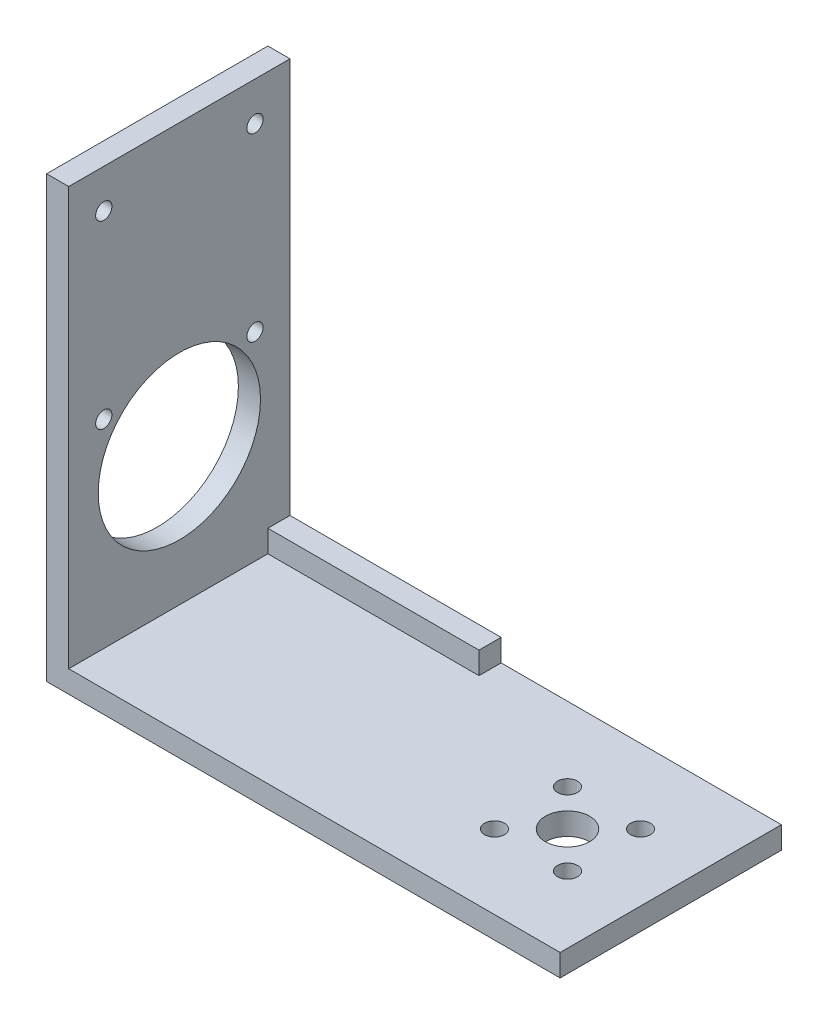
from build123d import *

# Parameters (mm, degrees)
S_BOX1_W      = 69.625
S_BOX1_H      = 3
BOSS_1_DEPTH  = 30
S_BOX2_W      = 3
S_BOX2_H      = 57.125
BOSS_2_DEPTH  = 30
S_BOX3_W      = 29.125
S_BOX3_H      = 3.5
BOSS_3_DEPTH  = 3
S_HOLE4_R     = 3
HOLE_4_DEPTH  = 3.2
S_HOLE5_R     = 1.35
HOLE_5_DEPTH  = 3.2
S_HOLE6_R     = 1.35
HOLE_6_DEPTH  = 3.2
S_HOLE7_R     = 1.35
HOLE_7_DEPTH  = 3.2
S_HOLE8_R     = 1.35
HOLE_8_DEPTH  = 3.2
S_HOLE9_R     = 11
HOLE_9_DEPTH  = 3.2
S_HOLE10_R    = 1.1
HOLE_10_DEPTH = 3.2
S_HOLE11_R    = 1.1
HOLE_11_DEPTH = 3.2
S_HOLE12_R    = 1.1
HOLE_12_DEPTH = 3.2
S_HOLE13_R    = 1.1
HOLE_13_DEPTH = 3.2


with BuildPart() as part:
    # S_box1 → Boss_1 (new body)
    with BuildSketch(Plane.XY.offset(-15)):
        with Locations((-20.8125, -20.125)):
            Rectangle(S_BOX1_W, S_BOX1_H)
    extrude(amount=BOSS_1_DEPTH)

    # S_box2 → Boss_2 (add)
    with BuildSketch(Plane.XY.offset(-15)):
        with Locations((-54.125, 9.4375)):
            Rectangle(S_BOX2_W, S_BOX2_H)
    extrude(amount=BOSS_2_DEPTH)

    # S_box3 → Boss_3 (add)
    with BuildSketch(Plane.XY.offset(-15)):
        with Locations((-38.5625, -17.375)):
            Rectangle(S_BOX3_W, S_BOX3_H)
    extrude(amount=BOSS_3_DEPTH)

    # S_hole4 → Hole_4 (cut)
    with BuildSketch(Plane(origin=(0, -21.725, 0), x_dir=(1, 0, 0), z_dir=(0, 1, 0))):
        Circle(S_HOLE4_R)
    extrude(amount=HOLE_4_DEPTH, mode=Mode.SUBTRACT)

    # S_hole5 → Hole_5 (cut)
    with BuildSketch(Plane(origin=(0, -21.725, 0), x_dir=(1, 0, 0), z_dir=(0, 1, 0))):
        with Locations((4.949747468, -4.949747468)):
            Circle(S_HOLE5_R)
    extrude(amount=HOLE_5_DEPTH, mode=Mode.SUBTRACT)

    # S_hole6 → Hole_6 (cut)
    with BuildSketch(Plane(origin=(0, -21.725, 0), x_dir=(1, 0, 0), z_dir=(0, 1, 0))):
        with Locations((-4.949747468, -4.949747468)):
            Circle(S_HOLE6_R)
    extrude(amount=HOLE_6_DEPTH, mode=Mode.SUBTRACT)

    # S_hole7 → Hole_7 (cut)
    with BuildSketch(Plane(origin=(0, -21.725, 0), x_dir=(1, 0, 0), z_dir=(0, 1, 0))):
        with Locations((-4.949747468, 4.949747468)):
            Circle(S_HOLE7_R)
    extrude(amount=HOLE_7_DEPTH, mode=Mode.SUBTRACT)

    # S_hole8 → Hole_8 (cut)
    with BuildSketch(Plane(origin=(0, -21.725, 0), x_dir=(1, 0, 0), z_dir=(0, 1, 0))):
        with Locations((4.949747468, 4.949747468)):
            Circle(S_HOLE8_R)
    extrude(amount=HOLE_8_DEPTH, mode=Mode.SUBTRACT)

    # S_hole9 → Hole_9 (cut)
    with BuildSketch(Plane(origin=(-55.725, 0, 0), x_dir=(0, 0, -1), z_dir=(1, 0, 0))):
        Circle(S_HOLE9_R)
    extrude(amount=HOLE_9_DEPTH, mode=Mode.SUBTRACT)

    # S_hole10 → Hole_10 (cut)
    with BuildSketch(Plane(origin=(-55.725, 0, 0), x_dir=(0, 0, -1), z_dir=(1, 0, 0))):
        with Locations((10.25, 8.3)):
            Circle(S_HOLE10_R)
    extrude(amount=HOLE_10_DEPTH, mode=Mode.SUBTRACT)

    # S_hole11 → Hole_11 (cut)
    with BuildSketch(Plane(origin=(-55.725, 0, 0), x_dir=(0, 0, -1), z_dir=(1, 0, 0))):
        with Locations((-10.25, 8.3)):
            Circle(S_HOLE11_R)
    extrude(amount=HOLE_11_DEPTH, mode=Mode.SUBTRACT)

    # S_hole12 → Hole_12 (cut)
    with BuildSketch(Plane(origin=(-55.725, 0, 0), x_dir=(0, 0, -1), z_dir=(1, 0, 0))):
        with Locations((10.25, 32.75)):
            Circle(S_HOLE12_R)
    extrude(amount=HOLE_12_DEPTH, mode=Mode.SUBTRACT)

    # S_hole13 → Hole_13 (cut)
    with BuildSketch(Plane(origin=(-55.725, 0, 0), x_dir=(0, 0, -1), z_dir=(1, 0, 0))):
        with Locations((-10.25, 32.75)):
            Circle(S_HOLE13_R)
    extrude(amount=HOLE_13_DEPTH, mode=Mode.SUBTRACT)


solid = part.part
